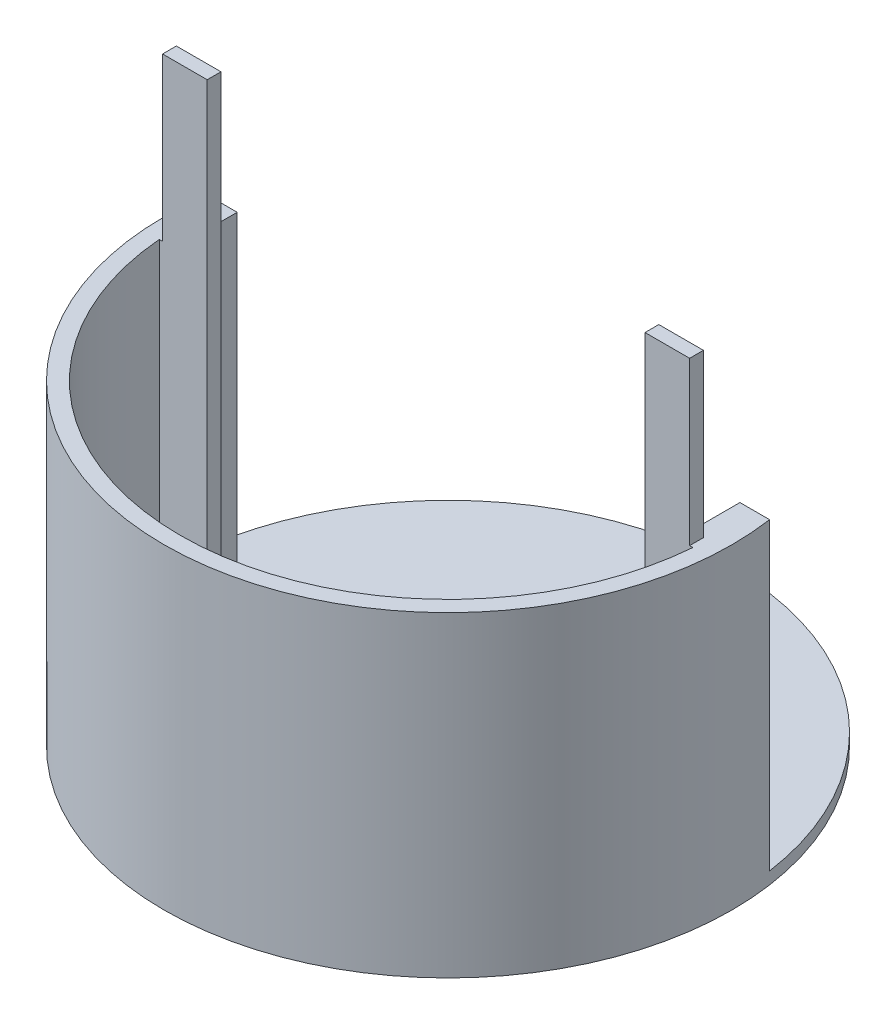
from build123d import *
from build123d.topology import SkipClean

# Parameters (mm, degrees)
SKETCH1_R           = 35
SKETCH1_R_2         = 2.75
BOSS_EXTRUDE1_DEPTH = 1.5
BOSS_EXTRUDE2_DEPTH = 37.5
SKETCH3_W           = 5.5
SKETCH3_H           = 1.7
BOSS_EXTRUDE3_DEPTH = 20


with BuildPart() as part:
    # Sketch1 → Boss-Extrude1 (new body)
    with BuildSketch(Plane(origin=(0, 0, 0), x_dir=(1, 0, 0), z_dir=(0, 1, 0))):
        Circle(SKETCH1_R)
        with Locations((-27, -7.4)):
            Circle(SKETCH1_R_2, mode=Mode.SUBTRACT)
        with Locations((27, -7.4)):
            Circle(SKETCH1_R_2, mode=Mode.SUBTRACT)
    extrude(amount=BOSS_EXTRUDE1_DEPTH)

    # Sketch2 → Boss-Extrude2 (add)
    with SkipClean():  # the faces are left unmerged after this step: merging them gives an invalid solid
        with BuildSketch(Plane(origin=(0, 1.5, 0), x_dir=(1, 0, 0), z_dir=(0, 1, 0))):
            with BuildLine():
                Line((-30.985278187, -1), (-26.984845005, -1))
                Line((-26.984845005, -1), (-26.984845005, -2.7))
                Line((-26.984845005, -2.7), (-32.889359982, -2.7))
                ThreePointArc((-32.889359982, -2.7), (0, -33), (32.889359982, -2.7))
                Line((32.889359982, -2.7), (26.984845005, -2.7))
                Line((26.984845005, -2.7), (26.984845005, -1))
                Line((26.984845005, -1), (30.985278187, -1))
                Line((30.985278187, -1), (30.985278187, 5))
                Line((30.985278187, 5), (34.641016151, 5))
                ThreePointArc((34.641016151, 5), (34.942385384, 2.007412189), (34.985711369, -1))
                ThreePointArc((34.985711369, -1), (0, -35), (-34.985711369, -1))
                ThreePointArc((-34.985711369, -1), (-34.942385384, 2.007412189), (-34.641016151, 5))
                Line((-34.641016151, 5), (-30.985278187, 5))
                Line((-30.985278187, 5), (-30.985278187, -1))
            make_face()
        extrude(amount=BOSS_EXTRUDE2_DEPTH)

    # Sketch3 → Boss-Extrude3 (add)
    with SkipClean():  # the faces are left unmerged after this step: merging them gives an invalid solid
        with BuildSketch(Plane(origin=(0, 39, 0), x_dir=(1, 0, 0), z_dir=(0, 1, 0))):
            with Locations((-29.734845005, -1.85)):
                Rectangle(SKETCH3_W, SKETCH3_H)
            with Locations((29.734845005, -1.85)):
                Rectangle(SKETCH3_W, SKETCH3_H)
        extrude(amount=BOSS_EXTRUDE3_DEPTH)


solid = part.part
